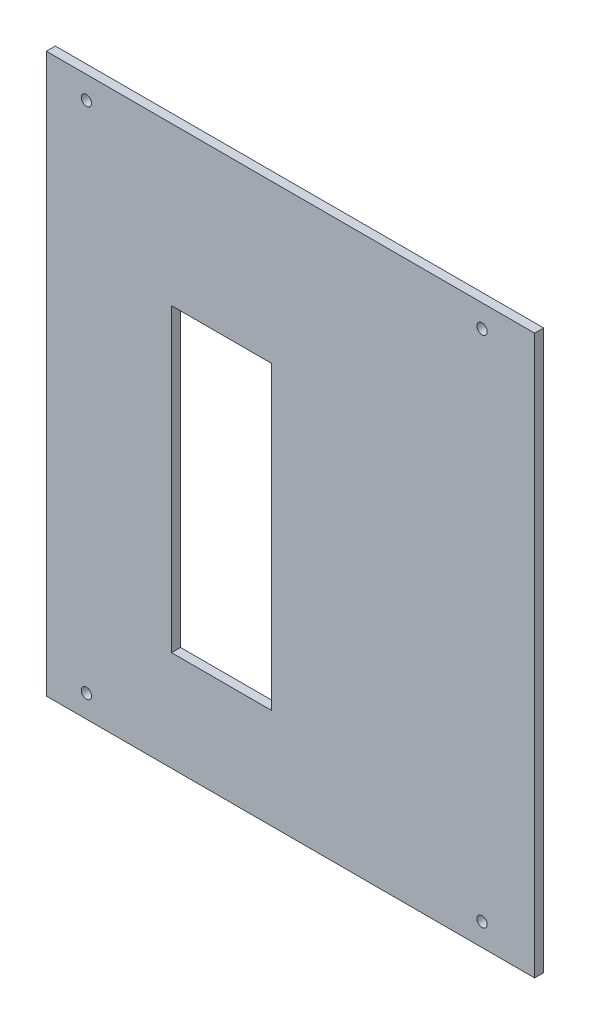
from build123d import *

# Parameters (mm, degrees)
ESQUISSE1_W        = 195
ESQUISSE1_H        = 223
ESQUISSE1_R        = 2.05
ESQUISSE1_W_2      = 40
ESQUISSE1_H_2      = 120
BOSS_EXTRU_1_DEPTH = 3.6


with BuildPart() as part:
    # Esquisse1 → Boss.-Extru.1 (new body)
    with BuildSketch(Plane.XY):
        with Locations((-22.5, 0)):
            Rectangle(ESQUISSE1_W, ESQUISSE1_H)
        with Locations((-104, 102.5)):
            Circle(ESQUISSE1_R, mode=Mode.SUBTRACT)
        with Locations((54, 102.5)):
            Circle(ESQUISSE1_R, mode=Mode.SUBTRACT)
        with Locations((54, -102.5)):
            Circle(ESQUISSE1_R, mode=Mode.SUBTRACT)
        with Locations((-104, -102.5)):
            Circle(ESQUISSE1_R, mode=Mode.SUBTRACT)
        with Locations((-50, -11.5)):
            Rectangle(ESQUISSE1_W_2, ESQUISSE1_H_2, mode=Mode.SUBTRACT)
    extrude(amount=BOSS_EXTRU_1_DEPTH)


solid = part.part
